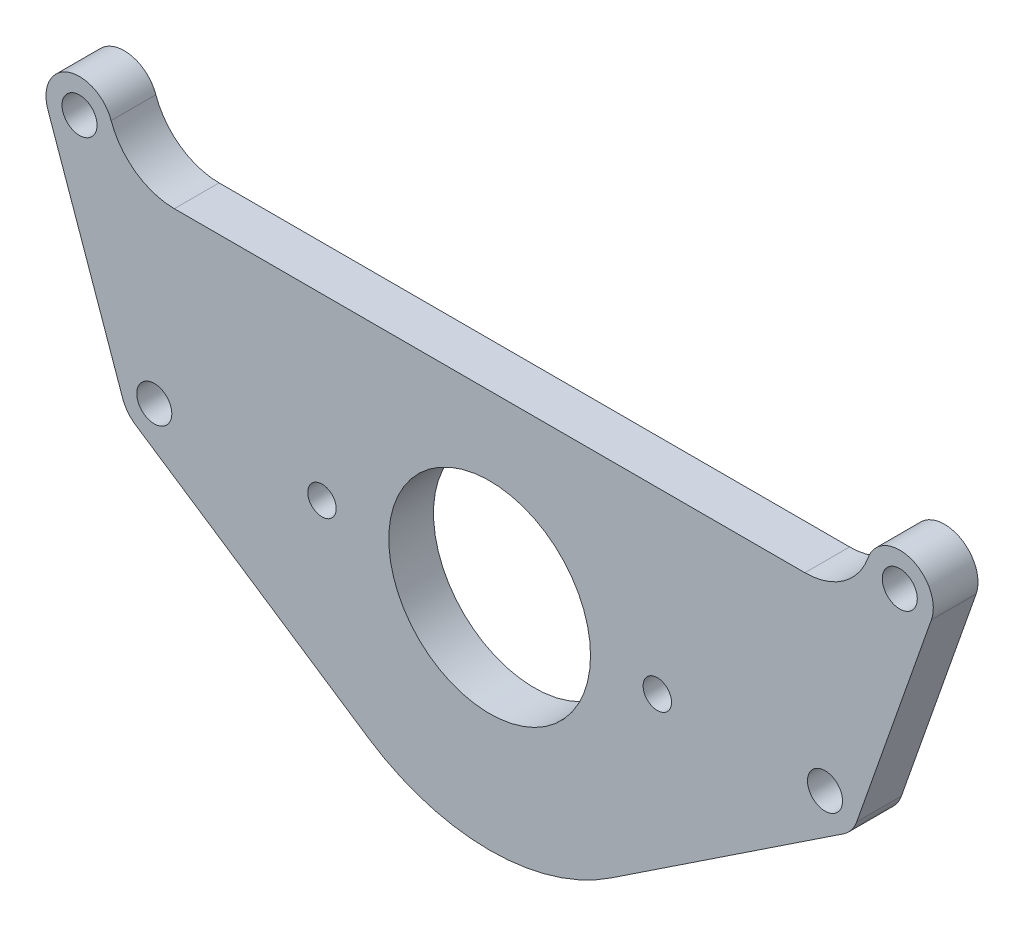
from build123d import *

# Parameters (mm, degrees)
CROQUIS2_R                    = 2.0193
CROQUIS2_R_2                  = 14.3256
CROQUIS2_R_3                  = 2.4892
SALIENTE_EXTRUIR1_DEPTH       = 6.35
CROQUIS4_R                    = 11.1125
CROQUIS4_R_2                  = 2.0193
CROQUIS4_R_3                  = 14.3256
CROQUIS4_R_4                  = 2.4892
CROQUIS4_R_5                  = 12.7
SALIENTE_EXTRUIR2_DEPTH       = 6.35
SALIENTE_EXTRUIR3_OUTLINE_R   = 2.4892
SALIENTE_EXTRUIR3_OUTLINE_R_2 = 11.1125
SALIENTE_EXTRUIR3_DEPTH       = 3.175


# Read off the part's stored shape, not the designer's step: Saliente-Extruir3
with BuildPart() as part:
    # Croquis2 → Saliente-Extruir1 (new body)
    with BuildSketch(Plane.XY):
        with BuildLine():
            Line((-50.26025, -3.966971602), (-17.216966667, -25.917547797))
            ThreePointArc((-17.216966667, -25.917547797), (0, -31.115), (17.216966667, -25.917547797))
            Line((17.216966667, -25.917547797), (50.26025, -3.966971602))
            ThreePointArc((50.26025, -3.966971602), (51.383179934, -2.925318757), (52.117388984, -1.581090594))
            Line((52.117388984, -1.581090594), (62.733042527, 28.581409406))
            ThreePointArc((62.733042527, 28.581409406), (59.824949243, 34.653759666), (53.750525482, 31.75))
            ThreePointArc((53.750525482, 31.75), (50.269530675, 27.147870067), (44.770269361, 25.4))
            Line((44.770269361, 25.4), (-44.770269361, 25.4))
            ThreePointArc((-44.770269361, 25.4), (-50.269530675, 27.147870067), (-53.750525482, 31.75))
            ThreePointArc((-53.750525482, 31.75), (-59.824949243, 34.653759666), (-62.733042527, 28.581409406))
            Line((-62.733042527, 28.581409406), (-52.117388984, -1.581090594))
            ThreePointArc((-52.117388984, -1.581090594), (-51.383179934, -2.925318757), (-50.26025, -3.966971602))
        make_face()
        with Locations((23.8125, 0)):
            Circle(CROQUIS2_R, mode=Mode.SUBTRACT)
        with Locations((-23.8125, 0)):
            Circle(CROQUIS2_R, mode=Mode.SUBTRACT)
        Circle(CROQUIS2_R_2, mode=Mode.SUBTRACT)
        with Locations((-47.625, 0)):
            Circle(CROQUIS2_R_3, mode=Mode.SUBTRACT)
        with Locations((47.625, 0)):
            Circle(CROQUIS2_R_3, mode=Mode.SUBTRACT)
        with Locations((-58.240653543, 30.1625)):
            Circle(CROQUIS2_R_3, mode=Mode.SUBTRACT)
        with Locations((58.240653543, 30.1625)):
            Circle(CROQUIS2_R_3, mode=Mode.SUBTRACT)
    extrude(amount=SALIENTE_EXTRUIR1_DEPTH)


with BuildPart() as body_2:
    # Croquis4 → Saliente-Extruir2 (new body)
    with BuildSketch(Plane.XY):
        with BuildLine():
            Line((-63.003153543, 56.9875), (-63.003153543, 30.1625))
            ThreePointArc((-63.003153543, 30.1625), (-62.935140138, 29.360501336), (-62.733042527, 28.581409406))
            Line((-62.733042527, 28.581409406), (-52.117388984, -1.581090594))
            ThreePointArc((-52.117388984, -1.581090594), (-51.383179934, -2.925318757), (-50.26025, -3.966971602))
            Line((-50.26025, -3.966971602), (-17.216966667, -25.917547797))
            ThreePointArc((-17.216966667, -25.917547797), (0, -31.115), (17.216966667, -25.917547797))
            Line((17.216966667, -25.917547797), (50.26025, -3.966971602))
            ThreePointArc((50.26025, -3.966971602), (51.383179934, -2.925318757), (52.117388984, -1.581090594))
            Line((52.117388984, -1.581090594), (62.733042527, 28.581409406))
            ThreePointArc((62.733042527, 28.581409406), (62.935140138, 29.360501336), (63.003153543, 30.1625))
            Line((63.003153543, 30.1625), (63.003153543, 56.9875))
            ThreePointArc((63.003153543, 56.9875), (54.216356978, 78.200703436), (33.003153543, 86.9875))
            Line((33.003153543, 86.9875), (-33.003153543, 86.9875))
            ThreePointArc((-33.003153543, 86.9875), (-54.216356978, 78.200703436), (-63.003153543, 56.9875))
        make_face()
        with Locations((0, 40.64)):
            Circle(CROQUIS4_R, mode=Mode.SUBTRACT)
        with Locations((-16.145831218, -9.3218)):
            Circle(CROQUIS4_R_2, mode=Mode.SUBTRACT)
        Circle(CROQUIS4_R_3, mode=Mode.SUBTRACT)
        with Locations((0, 18.6436)):
            Circle(CROQUIS4_R_2, mode=Mode.SUBTRACT)
        with Locations((16.145831218, -9.3218)):
            Circle(CROQUIS4_R_2, mode=Mode.SUBTRACT)
        with Locations((-47.625, 0)):
            Circle(CROQUIS4_R_4, mode=Mode.SUBTRACT)
        with Locations((47.625, 0)):
            Circle(CROQUIS4_R_4, mode=Mode.SUBTRACT)
        with Locations((-29.02971813, 82.074783851)):
            Circle(CROQUIS4_R_4, mode=Mode.SUBTRACT)
        with Locations((-36.976588955, 31.900216149)):
            Circle(CROQUIS4_R_4, mode=Mode.SUBTRACT)
        with Locations((-33.003153543, 56.9875)):
            Circle(CROQUIS4_R_5, mode=Mode.SUBTRACT)
        with Locations((-58.090437394, 60.960935412)):
            Circle(CROQUIS4_R_4, mode=Mode.SUBTRACT)
        with Locations((-58.240653543, 30.1625)):
            Circle(CROQUIS4_R_4, mode=Mode.SUBTRACT)
        with Locations((58.090437394, 60.960935412)):
            Circle(CROQUIS4_R_4, mode=Mode.SUBTRACT)
        with Locations((36.976588955, 31.900216149)):
            Circle(CROQUIS4_R_4, mode=Mode.SUBTRACT)
        with Locations((33.003153543, 56.9875)):
            Circle(CROQUIS4_R_5, mode=Mode.SUBTRACT)
        with Locations((29.02971813, 82.074783851)):
            Circle(CROQUIS4_R_4, mode=Mode.SUBTRACT)
        with Locations((58.240653543, 30.1625)):
            Circle(CROQUIS4_R_4, mode=Mode.SUBTRACT)
    extrude(amount=-SALIENTE_EXTRUIR2_DEPTH)


with BuildPart() as body_3:
    # Saliente-Extruir3 outline → Saliente-Extruir3 (new body)
    with BuildSketch(Plane.XY):
        with BuildLine():
            Line((-35.881109014, 27.265420582), (-22.987624276, 30.312923688))
            ThreePointArc((-22.987624276, 30.312923688), (-18.059295743, 30.166513899), (-13.86444293, 27.575555036))
            ThreePointArc((-13.86444293, 27.575555036), (0, 21.59), (13.86444293, 27.575555036))
            ThreePointArc((13.86444293, 27.575555036), (18.059295743, 30.166513899), (22.987624276, 30.312923688))
            Line((22.987624276, 30.312923688), (35.881109014, 27.265420582))
            ThreePointArc((35.881109014, 27.265420582), (41.611384522, 30.804736208), (38.072068895, 36.535011716))
            Line((38.072068895, 36.535011716), (23.323178626, 40.021058337))
            ThreePointArc((23.323178626, 40.021058337), (20.26820543, 41.736288231), (18.58786391, 44.81058932))
            ThreePointArc((18.58786391, 44.81058932), (18.032030897, 46.783969542), (17.267348762, 48.686189579))
            ThreePointArc((17.267348762, 48.686189579), (16.412494406, 53.542019269), (18.100083663, 58.174718315))
            Line((18.100083663, 58.174718315), (32.93018787, 79.342066878))
            ThreePointArc((32.93018787, 79.342066878), (31.762435104, 85.975253591), (25.129248391, 84.807500825))
            Line((25.129248391, 84.807500825), (11.314654439, 65.08961339))
            ThreePointArc((11.314654439, 65.08961339), (6.613405383, 61.027851685), (0.54804108, 59.682115192))
            ThreePointArc((0.54804108, 59.682115192), (0, 59.69), (-0.54804108, 59.682115192))
            ThreePointArc((-0.54804108, 59.682115192), (-6.613405383, 61.027851685), (-11.314654439, 65.08961339))
            Line((-11.314654439, 65.08961339), (-25.129248391, 84.807500825))
            ThreePointArc((-25.129248391, 84.807500825), (-31.762435104, 85.975253591), (-32.93018787, 79.342066878))
            Line((-32.93018787, 79.342066878), (-18.100083663, 58.174718315))
            ThreePointArc((-18.100083663, 58.174718315), (-16.412494406, 53.542019269), (-17.267348762, 48.686189579))
            ThreePointArc((-17.267348762, 48.686189579), (-18.032030897, 46.783969542), (-18.58786391, 44.81058932))
            ThreePointArc((-18.58786391, 44.81058932), (-20.26820543, 41.736288231), (-23.323178626, 40.021058337))
            Line((-23.323178626, 40.021058337), (-38.072068895, 36.535011716))
            ThreePointArc((-38.072068895, 36.535011716), (-41.611384522, 30.804736208), (-35.881109014, 27.265420582))
        make_face()
        with Locations((-36.976588955, 31.900216149)):
            Circle(SALIENTE_EXTRUIR3_OUTLINE_R, mode=Mode.SUBTRACT)
        with Locations((36.976588955, 31.900216149)):
            Circle(SALIENTE_EXTRUIR3_OUTLINE_R, mode=Mode.SUBTRACT)
        with Locations((0, 40.64)):
            Circle(SALIENTE_EXTRUIR3_OUTLINE_R_2, mode=Mode.SUBTRACT)
        with Locations((-29.02971813, 82.074783851)):
            Circle(SALIENTE_EXTRUIR3_OUTLINE_R, mode=Mode.SUBTRACT)
        with Locations((29.02971813, 82.074783851)):
            Circle(SALIENTE_EXTRUIR3_OUTLINE_R, mode=Mode.SUBTRACT)
    extrude(amount=SALIENTE_EXTRUIR3_DEPTH)


solid = part.part
